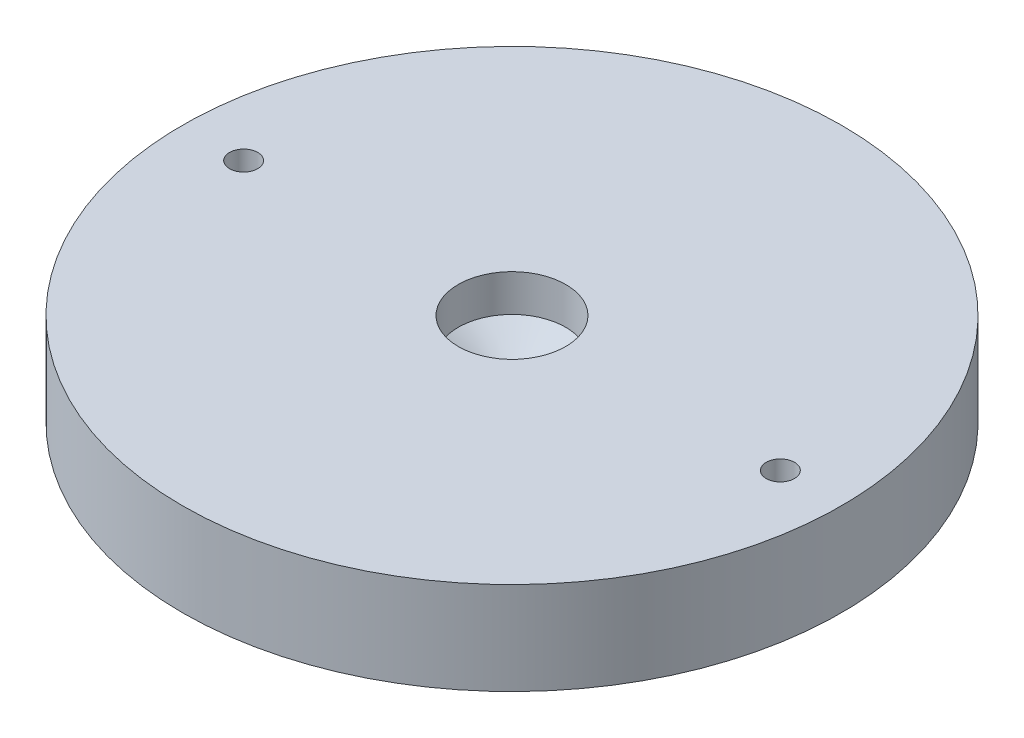
from build123d import *

# Parameters (mm, degrees)
SKETCH1_R                = 17.78
SKETCH1_R_2              = 0.762
BOSS_EXTRUDE1_DEPTH      = 5
SKETCH5_R                = 2.032
CUT_EXTRUDE1_DEPTH       = 3
M5_CLEARANCE_HOLE2_D     = 5.8
M5_CLEARANCE_HOLE2_DEPTH = 1.999996
M5_CLEARANCE_HOLE2_TIP   = 1.742495795


with BuildPart() as part:
    # Sketch1 → Boss-Extrude1 (new body)
    with BuildSketch(Plane(origin=(0, 0, 0), x_dir=(1, 0, 0), z_dir=(0, 1, 0))):
        Circle(SKETCH1_R)
        with Locations((-14.478, 0)):
            Circle(SKETCH1_R_2, mode=Mode.SUBTRACT)
        with Locations((14.478, 0)):
            Circle(SKETCH1_R_2, mode=Mode.SUBTRACT)
    extrude(amount=BOSS_EXTRUDE1_DEPTH)

    # Sketch5 → Cut-Extrude1 (cut)
    with BuildSketch(Plane.XZ):
        with Locations((0, 13.97)):
            Circle(SKETCH5_R)
    extrude(amount=-CUT_EXTRUDE1_DEPTH, mode=Mode.SUBTRACT)

    # M5 Clearance Hole2
    with Locations(Plane(origin=(0, 5, 0), x_dir=(1, 0, 0), z_dir=(0, 1, 0))):
        with Locations((0, 0)):
            Hole(M5_CLEARANCE_HOLE2_D / 2, depth=M5_CLEARANCE_HOLE2_DEPTH)
            with Locations((0, 0, -(M5_CLEARANCE_HOLE2_DEPTH + M5_CLEARANCE_HOLE2_TIP / 2))):  # 118° drill point
                Cone(0, M5_CLEARANCE_HOLE2_D / 2, M5_CLEARANCE_HOLE2_TIP, mode=Mode.SUBTRACT)


solid = part.part
